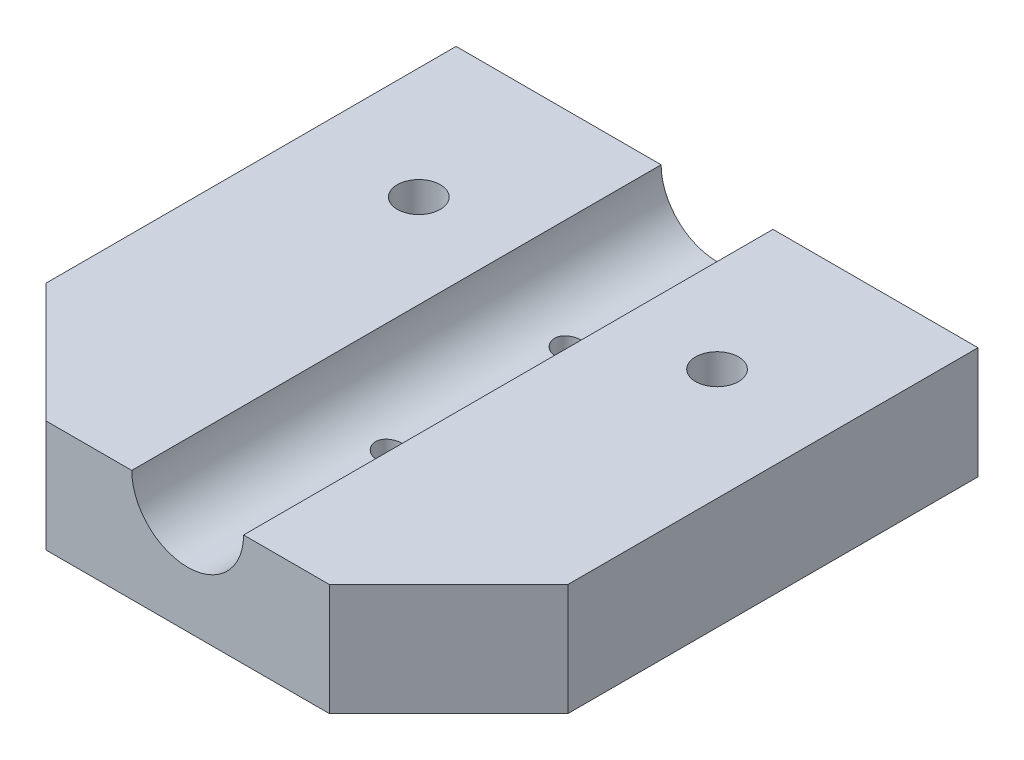
from build123d import *

# Parameters (mm, degrees)
SKETCH1_W                                     = 44.45
SKETCH1_H                                     = 45.085
BOSS_EXTRUDE1_DEPTH                           = 9.525
SKETCH4_R                                     = 4.7625
CUT_EXTRUDE1_DEPTH                            = 52.159881499
MOTORHOLES_D                                  = 2.2606
MOTORHOLES_DEPTH                              = 6.35
MOTORHOLES_TIP                                = 0.679152758
CBORE_FOR_6_SOCKET_HEAD_CAP_SCREW1_AT_2_COUNT = 2
CBORE_FOR_6_SOCKET_HEAD_CAP_SCREW1_AT_2_PITCH = 25.4
CHAMFER1_SIZE                                 = 10.16
F_4_40_TAPPED_HOLE1_D                         = 2.2606


with BuildPart() as part:
    # Sketch1 → Boss-Extrude1 (new body)
    with BuildSketch(Plane(origin=(0, 0, 0), x_dir=(1, 0, 0), z_dir=(0, 1, 0))):
        Rectangle(SKETCH1_W, SKETCH1_H)
    extrude(amount=BOSS_EXTRUDE1_DEPTH)

    # Sketch4 → Cut-Extrude1 (cut, through all)
    with BuildSketch(Plane.XY.offset(22.5425)):
        with Locations((0, 9.525)):
            Circle(SKETCH4_R)
    extrude(amount=-CUT_EXTRUDE1_DEPTH, mode=Mode.SUBTRACT)

    # MotorHoles
    with Locations(Plane(origin=(0, 0, 0), x_dir=(-1, 0, 0), z_dir=(0, -1, 0))):
        with Locations((-5.715, -19.3675), (5.715, -19.3675)):
            Hole(MOTORHOLES_D / 2, depth=MOTORHOLES_DEPTH)
            with Locations((0, 0, -(MOTORHOLES_DEPTH + MOTORHOLES_TIP / 2))):  # 118° drill point
                Cone(0, MOTORHOLES_D / 2, MOTORHOLES_TIP, mode=Mode.SUBTRACT)

    # Sketch5 → CBORE for #6 Socket Head Cap Screw1 (revolve, cut)
    with BuildSketch(Plane(origin=(12.7, 0, -9.8425), x_dir=(0, 0, -1), z_dir=(1, 0, 0))):
        Polygon((0, 0), (0, 9.525), (1.8288, 9.525), (1.8288, 3.5052), (3.57251, 3.5052), (3.57251, 0.635), (4.20751, 0), align=None)
    cbore_for_6_socket_head_cap_screw1 = revolve(axis=Axis((12.7, -6.35, -9.8425), (0, 1, 0)), mode=Mode.SUBTRACT)

    # CBORE for #6 Socket Head Cap Screw1 at 2: CBORE for #6 Socket Head Cap Screw1 ×2
    with Locations(*[(-i * CBORE_FOR_6_SOCKET_HEAD_CAP_SCREW1_AT_2_PITCH, 0, 0) for i in range(1, CBORE_FOR_6_SOCKET_HEAD_CAP_SCREW1_AT_2_COUNT)]):
        add(cbore_for_6_socket_head_cap_screw1, mode=Mode.SUBTRACT)

    # Chamfer1
    chamfer1_edges = [part.edges().sort_by_distance(p)[0] for p in [
        (22.225, 4.7625, 22.5425),
        (-22.225, 4.7625, 22.5425),
    ]]
    chamfer(chamfer1_edges, length=CHAMFER1_SIZE)

    # #4-40 Tapped Hole1 (through all)
    with Locations(Plane(origin=(0, 0, 0), x_dir=(-1, 0, 0), z_dir=(0, -1, 0))):
        with Locations((0, 9.8425), (0, -5.3975)):
            Hole(F_4_40_TAPPED_HOLE1_D / 2)


solid = part.part
